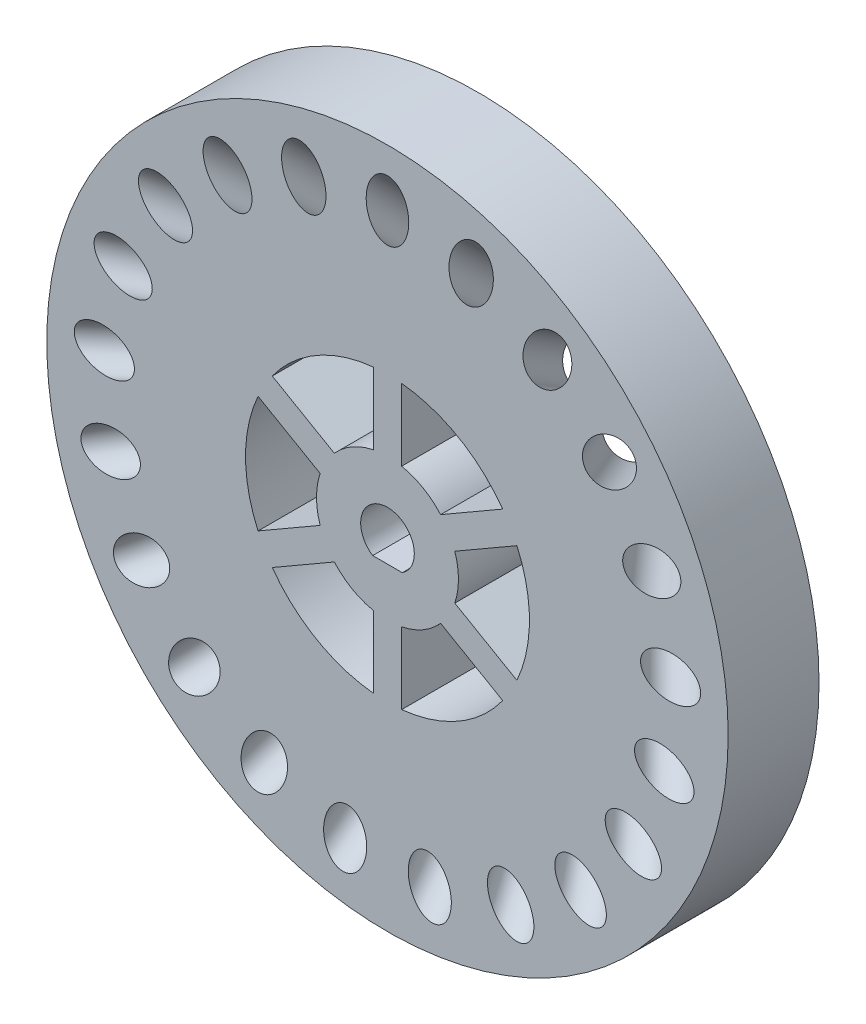
from build123d import *

# Parameters (mm, degrees)
SKETCH1_R           = 38.1
BOSS_EXTRUDE1_DEPTH = 10.16
SKETCH5_R           = 2.38125
CUT_EXTRUDE1_DEPTH  = 68.947967225
CIRPATTERN1_COUNT   = 21
CUT_EXTRUDE2_DEPTH  = 18.288


with BuildPart() as part:
    # Sketch1 → Boss-Extrude1 (new body)
    with BuildSketch(Plane.XY):
        Circle(SKETCH1_R)
        with BuildLine():
            Line((-1.658312395, -2.5), (1.658312395, -2.5))
            ThreePointArc((1.658312395, -2.5), (0, 3), (-1.658312395, -2.5))
        make_face(mode=Mode.SUBTRACT)
    extrude(amount=BOSS_EXTRUDE1_DEPTH)

    # Sketch5 → Cut-Extrude1 (cut, symmetric)
    with BuildSketch(Plane(origin=(0, 15.875, 15.875), x_dir=(0, 0.7071067811865476, -0.7071067811865475), z_dir=(0, -0.7071067811865475, -0.7071067811865476))):
        with Locations((15.266435406, 0)):
            Circle(SKETCH5_R)
    cut_extrude1 = extrude(amount=CUT_EXTRUDE1_DEPTH, both=True, mode=Mode.SUBTRACT)

    # CirPattern1: Cut-Extrude1 ×21 about axis
    cirpattern1_axis = Axis((0, 0, 10.16), (0, 0, -1))
    for i in range(1, CIRPATTERN1_COUNT):
        add(cut_extrude1.rotate(cirpattern1_axis, i * 360 / CIRPATTERN1_COUNT), mode=Mode.SUBTRACT)

    # Sketch6 → Cut-Extrude2 (cut)
    with BuildSketch(Plane(origin=(0, 0, 0), x_dir=(-1, 0, 0), z_dir=(0, 0, -1))):
        with BuildLine():
            Line((-1.5875, 7.777129933), (-1.5875, 15.795425564))
            ThreePointArc((-1.5875, 15.795425564), (-7.9375, 13.748153285), (-12.885489802, 9.272528111))
            Line((-12.885489802, 9.272528111), (-5.941442091, 5.263380295))
            ThreePointArc((-5.941442091, 5.263380295), (-3.96875, 6.874076643), (-1.5875, 7.777129933))
        make_face()
        with BuildLine():
            Line((1.5875, 15.795425564), (1.5875, 7.777129933))
            ThreePointArc((1.5875, 7.777129933), (3.96875, 6.874076643), (5.941442091, 5.263380295))
            Line((5.941442091, 5.263380295), (12.885489802, 9.272528111))
            ThreePointArc((12.885489802, 9.272528111), (7.9375, 13.748153285), (1.5875, 15.795425564))
        make_face()
        with BuildLine():
            Line((14.472989802, 6.522897454), (7.528942091, 2.513749638))
            ThreePointArc((7.528942091, 2.513749638), (7.9375, 0), (7.528942091, -2.513749638))
            Line((7.528942091, -2.513749638), (14.472989802, -6.522897454))
            ThreePointArc((14.472989802, -6.522897454), (15.875, 0), (14.472989802, 6.522897454))
        make_face()
        with BuildLine():
            Line((12.885489802, -9.272528111), (5.941442091, -5.263380295))
            ThreePointArc((5.941442091, -5.263380295), (3.96875, -6.874076643), (1.5875, -7.777129933))
            Line((1.5875, -7.777129933), (1.5875, -15.795425564))
            ThreePointArc((1.5875, -15.795425564), (7.9375, -13.748153285), (12.885489802, -9.272528111))
        make_face()
        with BuildLine():
            Line((-1.5875, -15.795425564), (-1.5875, -7.777129933))
            ThreePointArc((-1.5875, -7.777129933), (-3.96875, -6.874076643), (-5.941442091, -5.263380295))
            Line((-5.941442091, -5.263380295), (-12.885489802, -9.272528111))
            ThreePointArc((-12.885489802, -9.272528111), (-7.9375, -13.748153285), (-1.5875, -15.795425564))
        make_face()
        with BuildLine():
            Line((-14.472989802, -6.522897454), (-7.528942091, -2.513749638))
            ThreePointArc((-7.528942091, -2.513749638), (-7.9375, 0), (-7.528942091, 2.513749638))
            Line((-7.528942091, 2.513749638), (-14.472989802, 6.522897454))
            ThreePointArc((-14.472989802, 6.522897454), (-15.875, 0), (-14.472989802, -6.522897454))
        make_face()
    extrude(amount=-CUT_EXTRUDE2_DEPTH, mode=Mode.SUBTRACT)


solid = part.part
